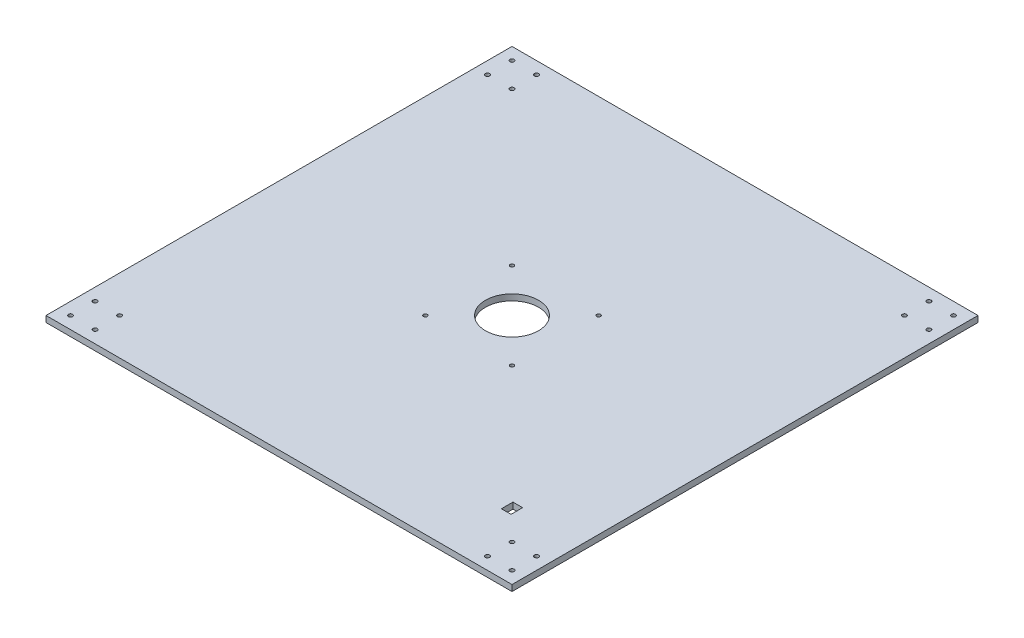
from build123d import *

# Parameters (mm, degrees)
SKETCH1_W               = 482.6
SKETCH1_H               = 482.6
BOSS_EXTRUDE1_DEPTH     = 6.35
CUT_EXTRUDE1_DEPTH      = 342.30880812
CUT_EXTRUDE1_DEPTH_BACK = 342.30880812
SKETCH2_R               = 1.984375
SKETCH2_R_2             = 27.432
SKETCH3_W               = 10
SKETCH3_H               = 12
CUT_EXTRUDE2_DEPTH      = 342.30880812
SKETCH4_R               = 2.1828125
CUT_EXTRUDE3_DEPTH      = 342.30880812


with BuildPart() as part:
    # Sketch1 → Boss-Extrude1 (new body)
    with BuildSketch(Plane(origin=(0, 0, 0), x_dir=(1, 0, 0), z_dir=(0, 1, 0))):
        Rectangle(SKETCH1_W, SKETCH1_H)
    extrude(amount=BOSS_EXTRUDE1_DEPTH)

    # Sketch2 → Cut-Extrude1 (cut, two sides: drawn at the far end of the back side and taken through both)
    with BuildSketch(Plane(origin=(0, 6.35, 0), x_dir=(1, 0, 0), z_dir=(0, 1, 0)).offset(-CUT_EXTRUDE1_DEPTH_BACK)):
        with Locations((-44.8437, 44.8437)):
            Circle(SKETCH2_R)
        with Locations((44.8437, 44.8437)):
            Circle(SKETCH2_R)
        with Locations((-44.8437, -44.8437)):
            Circle(SKETCH2_R)
        with Locations((44.8437, -44.8437)):
            Circle(SKETCH2_R)
        Circle(SKETCH2_R_2)
    extrude(amount=CUT_EXTRUDE1_DEPTH + CUT_EXTRUDE1_DEPTH_BACK, mode=Mode.SUBTRACT)

    # Sketch3 → Cut-Extrude2 (cut, through all)
    with BuildSketch(Plane(origin=(0, 6.35, 0), x_dir=(1, 0, 0), z_dir=(0, 1, 0))):
        with Locations((172.869930331, -172.869930331)):
            Rectangle(SKETCH3_W, SKETCH3_H)
    extrude(amount=-CUT_EXTRUDE2_DEPTH, mode=Mode.SUBTRACT)

    # Sketch4 → Cut-Extrude3 (cut, through all)
    with BuildSketch(Plane(origin=(0, 6.35, 0), x_dir=(1, 0, 0), z_dir=(0, 1, 0))):
        with Locations((-228.6, 228.6)):
            Circle(SKETCH4_R)
        with Locations((-203.2, 228.6)):
            Circle(SKETCH4_R)
        with Locations((-228.6, 203.2)):
            Circle(SKETCH4_R)
        with Locations((-203.2, 203.2)):
            Circle(SKETCH4_R)
        with Locations((203.2, 228.6)):
            Circle(SKETCH4_R)
        with Locations((203.2, 203.2)):
            Circle(SKETCH4_R)
        with Locations((228.6, 203.2)):
            Circle(SKETCH4_R)
        with Locations((228.6, 228.6)):
            Circle(SKETCH4_R)
        with Locations((203.2, -203.2)):
            Circle(SKETCH4_R)
        with Locations((228.6, -203.2)):
            Circle(SKETCH4_R)
        with Locations((228.6, -228.6)):
            Circle(SKETCH4_R)
        with Locations((203.2, -228.6)):
            Circle(SKETCH4_R)
        with Locations((-228.6, -203.2)):
            Circle(SKETCH4_R)
        with Locations((-203.2, -203.2)):
            Circle(SKETCH4_R)
        with Locations((-203.2, -228.6)):
            Circle(SKETCH4_R)
        with Locations((-228.6, -228.6)):
            Circle(SKETCH4_R)
    extrude(amount=-CUT_EXTRUDE3_DEPTH, mode=Mode.SUBTRACT)


solid = part.part
